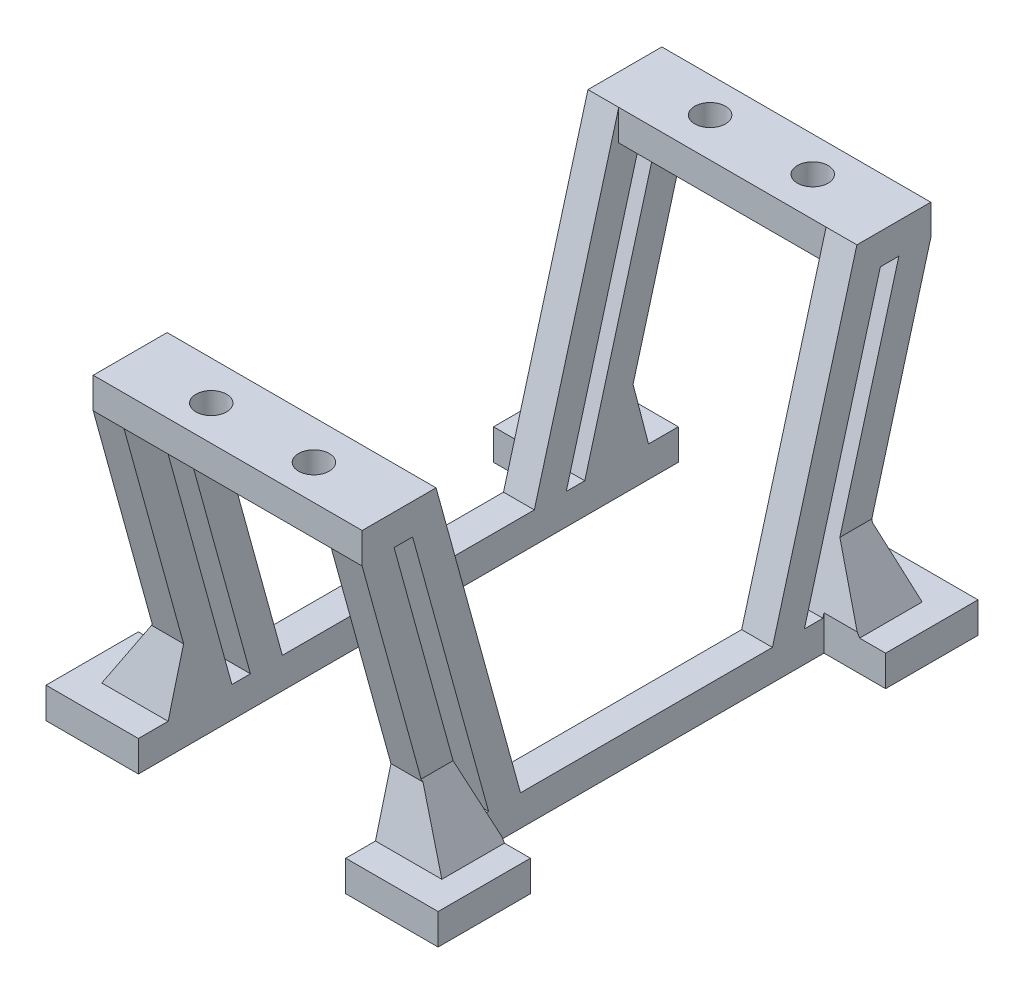
from build123d import *

# Parameters (mm, degrees)
BOSS_EXTRUDE2_DEPTH = 3
SKETCH6_W           = 7.2
SKETCH6_H           = 3
BOSS_EXTRUDE3_DEPTH = 10.1
SKETCH8_R           = 1.4975
CUT_EXTRUDE3_DEPTH  = 45.922405323
SKETCH9_W           = 9
SKETCH9_H           = 9
BOSS_EXTRUDE4_DEPTH = 3
CHAMFER2_SIZE       = 3.464101615
CHAMFER2_SIZE_2     = 6
CHAMFER2_SIZE_3     = 3.099985421


# Read off the part's stored shape, not the designer's step: Mirror10
with BuildPart() as part:
    # Sketch4 → Boss-Extrude2 (new body)
    with BuildSketch(Plane(origin=(10.1, 0, 0), x_dir=(0, 0, -1), z_dir=(1, 0, 0))):
        Polygon((0, 0), (20.3, 0), (20.3, 3), (27.7, 29.85), (27.7, 32.85), (20.5, 32.85), (12.273184358, 3), (0, 3), align=None)
        Polygon((22.785036556, 29.85), (15.385036556, 3), (17.188147801, 3), (24.588147801, 29.85), align=None, mode=Mode.SUBTRACT)
    boss_extrude2 = extrude(amount=BOSS_EXTRUDE2_DEPTH)

    # Sketch6 → Boss-Extrude3 (add)
    with BuildSketch(Plane.ZY.offset(-10.1)):
        with Locations((-24.1, 31.35)):
            Rectangle(SKETCH6_W, SKETCH6_H)
    boss_extrude3 = extrude(amount=BOSS_EXTRUDE3_DEPTH)

    # Sketch8 → Cut-Extrude3 (cut, through all)
    with BuildSketch(Plane(origin=(0, 32.85, 0), x_dir=(1, 0, 0), z_dir=(0, 1, 0))):
        with Locations(Location((5, 24.3, 0), (0, 0, 270))):
            Circle(SKETCH8_R)
    cut_extrude3 = extrude(amount=-CUT_EXTRUDE3_DEPTH, mode=Mode.SUBTRACT)

    # Sketch9 → Boss-Extrude4 (add)
    with BuildSketch(Plane.XZ):
        with Locations((14.6, -21.8)):
            Rectangle(SKETCH9_W, SKETCH9_H)
    boss_extrude4 = extrude(amount=-BOSS_EXTRUDE4_DEPTH)

    # Mirror9: Boss-Extrude2, Boss-Extrude3, Cut-Extrude3, Boss-Extrude4 across plane
    add(boss_extrude2.mirror(Plane(origin=(0, 0, 0), x_dir=(0, 0, 1), z_dir=(1, 0, 0))))
    add(boss_extrude3.mirror(Plane(origin=(0, 0, 0), x_dir=(0, 0, 1), z_dir=(1, 0, 0))))
    add(cut_extrude3.mirror(Plane(origin=(0, 0, 0), x_dir=(0, 0, 1), z_dir=(1, 0, 0))), mode=Mode.SUBTRACT)
    add(boss_extrude4.mirror(Plane(origin=(0, 0, 0), x_dir=(0, 0, 1), z_dir=(1, 0, 0))))

    # Mirror10: part across plane


with BuildPart() as part_1:
    add(part.part)
    add(part.part.mirror(Plane.XY))

    # Chamfer2
    # the kernel refuses this chamfer: 6, 3.464101615, 3.099985421 mm, written as the material it adds along each edge
    with BuildSketch(Plane(origin=(-13.1, 3, 17.3), x_dir=(-0.9983227437537925, -0.05789386240267071, 0), z_dir=(0, 0, 1))) as chamfer2_piece_1_section:
        Polygon((CHAMFER2_SIZE * 0.998322743793, -CHAMFER2_SIZE * 0.057893862405), (-CHAMFER2_SIZE_2 * 0.0578938624027, -CHAMFER2_SIZE_2 * 0.998322743754), (0, 0), align=None)
    chamfer2_piece_1 = extrude(amount=18.522514528, mode=Mode.PRIVATE)
    chamfer2_piece_1 = split(chamfer2_piece_1, bisect_by=Plane(origin=(-14.207429755, 4.623813367, 20.747531431), z_dir=(0, 0.2656988795293601, -0.9640560696436917)), keep=Keep.TOP, mode=Mode.PRIVATE)
    chamfer2_piece_1 = split(chamfer2_piece_1, bisect_by=Plane(origin=(-14.207429755, 5.420910005, 17.855363222), z_dir=(0, -0.26569887952935983, 0.9640560696436918)), keep=Keep.TOP, mode=Mode.PRIVATE)
    add(chamfer2_piece_1)
    with BuildSketch(Plane(origin=(-13.1, 3, -17.3), x_dir=(-0.9983227437537925, -0.05789386240267071, 0), z_dir=(0, 0, -1))) as chamfer2_piece_2_section:
        Polygon((CHAMFER2_SIZE * 0.998322743793, CHAMFER2_SIZE * 0.057893862405), (-CHAMFER2_SIZE_2 * 0.0578938624027, CHAMFER2_SIZE_2 * 0.998322743754), (0, 0), align=None)
    chamfer2_piece_2 = extrude(amount=18.522514528, mode=Mode.PRIVATE)
    chamfer2_piece_2 = split(chamfer2_piece_2, bisect_by=Plane(origin=(-14.207429755, 5.420910005, -17.855363222), z_dir=(0, -0.26569887952935983, -0.9640560696436918)), keep=Keep.TOP, mode=Mode.PRIVATE)
    chamfer2_piece_2 = split(chamfer2_piece_2, bisect_by=Plane(origin=(-14.207429755, 4.623813367, -20.747531431), z_dir=(0, 0.2656988795293601, 0.9640560696436917)), keep=Keep.TOP, mode=Mode.PRIVATE)
    add(chamfer2_piece_2)
    with BuildSketch(Plane(origin=(-10.1, 3, 20.3), x_dir=(0, -0.07329167604498149, 0.997310548536672), z_dir=(-1, 0, 0)), Plane(origin=(10.1, 3, -20.3), x_dir=(0, -0.07329167604498149, -0.997310548536672), z_dir=(1, 0, 0))) as chamfer2_piece_3:
        Polygon((CHAMFER2_SIZE_3 * 0.997310548488, CHAMFER2_SIZE_3 * 0.0732916760414), (CHAMFER2_SIZE_2 * 0.194327010143, CHAMFER2_SIZE_2 * 0.98093680384), (0, 0), align=None)
    extrude(amount=3)
    with BuildSketch(Plane(origin=(13.1, 3, 35.822514528), x_dir=(0.9983227437537925, -0.05789386240267071, 0), z_dir=(0, 0, -1))) as chamfer2_piece_4_section:
        Polygon((CHAMFER2_SIZE * 0.998322743793, -CHAMFER2_SIZE * 0.057893862405), (-CHAMFER2_SIZE_2 * 0.0578938624027, -CHAMFER2_SIZE_2 * 0.998322743754), (0, 0), align=None)
    chamfer2_piece_4 = extrude(amount=18.522514528, mode=Mode.PRIVATE)
    chamfer2_piece_4 = split(chamfer2_piece_4, bisect_by=Plane(origin=(14.207429755, 4.623813367, 20.747531431), z_dir=(0, 0.2656988795293601, -0.9640560696436917)), keep=Keep.TOP, mode=Mode.PRIVATE)
    chamfer2_piece_4 = split(chamfer2_piece_4, bisect_by=Plane(origin=(14.207429755, 5.420910005, 17.855363222), z_dir=(0, -0.26569887952935983, 0.9640560696436918)), keep=Keep.TOP, mode=Mode.PRIVATE)
    add(chamfer2_piece_4)
    with BuildSketch(Plane(origin=(13.1, 3, -35.822514528), x_dir=(0.9983227437537925, -0.05789386240267071, 0), z_dir=(0, 0, 1))) as chamfer2_piece_5_section:
        Polygon((CHAMFER2_SIZE * 0.998322743793, CHAMFER2_SIZE * 0.057893862405), (-CHAMFER2_SIZE_2 * 0.0578938624027, CHAMFER2_SIZE_2 * 0.998322743754), (0, 0), align=None)
    chamfer2_piece_5 = extrude(amount=18.522514528, mode=Mode.PRIVATE)
    chamfer2_piece_5 = split(chamfer2_piece_5, bisect_by=Plane(origin=(14.207429755, 4.623813367, -20.747531431), z_dir=(0, 0.2656988795293601, 0.9640560696436917)), keep=Keep.TOP, mode=Mode.PRIVATE)
    chamfer2_piece_5 = split(chamfer2_piece_5, bisect_by=Plane(origin=(14.207429755, 5.420910005, -17.855363222), z_dir=(0, -0.26569887952935983, -0.9640560696436918)), keep=Keep.TOP, mode=Mode.PRIVATE)
    add(chamfer2_piece_5)
    with BuildSketch(Plane(origin=(10.1, 3, 20.3), x_dir=(0, 0.9690111038190681, 0.24701716676245647), z_dir=(1, 0, 0))) as chamfer2_piece_6:
        Polygon((CHAMFER2_SIZE_2 * 0.999813220622, CHAMFER2_SIZE_2 * 0.0193267656127), (CHAMFER2_SIZE_3 * 0.247017166751, CHAMFER2_SIZE_3 * 0.969011103772), (0, 0), align=None)
    extrude(amount=3)
    with BuildSketch(Plane(origin=(-10.1, 3, -20.3), x_dir=(0, -0.07329167604498149, -0.997310548536672), z_dir=(-1, 0, 0))) as chamfer2_piece_7:
        Polygon((CHAMFER2_SIZE_3 * 0.997310548488, -CHAMFER2_SIZE_3 * 0.0732916760414), (CHAMFER2_SIZE_2 * 0.194327010143, -CHAMFER2_SIZE_2 * 0.98093680384), (0, 0), align=None)
    extrude(amount=3)
    with BuildSketch(Plane(origin=(-13.1, 3, 17.3), x_dir=(-0.9983227437537925, -0.05789386240267071, 0), z_dir=(0, 0, 1))) as chamfer2_piece_8a_section:
        Polygon((CHAMFER2_SIZE * 0.998322743793, -CHAMFER2_SIZE * 0.057893862405), (-CHAMFER2_SIZE_2 * 0.0578938624027, -CHAMFER2_SIZE_2 * 0.998322743754), (0, 0), align=None)
    chamfer2_piece_8a = extrude(amount=18.522514528, mode=Mode.PRIVATE)
    chamfer2_piece_8a = split(chamfer2_piece_8a, bisect_by=Plane(origin=(-14.24841762, 4.892203589, 26.3), z_dir=(0, 0, -1)), keep=Keep.TOP, mode=Mode.PRIVATE)
    chamfer2_piece_8a = split(chamfer2_piece_8a, bisect_by=Plane(origin=(-14.24841762, 5.593858539, 21.014880938), z_dir=(0, -0.2656988795293601, 0.9640560696436917)), keep=Keep.TOP, mode=Mode.PRIVATE)
    with BuildSketch(Plane(origin=(-10.1, 3, 20.3), x_dir=(0, -0.07329167604498149, 0.997310548536672), z_dir=(-1, 0, 0))) as chamfer2_piece_8b_section:
        Polygon((CHAMFER2_SIZE_3 * 0.997310548488, CHAMFER2_SIZE_3 * 0.0732916760414), (CHAMFER2_SIZE_2 * 0.194327010143, CHAMFER2_SIZE_2 * 0.98093680384), (0, 0), align=None)
    chamfer2_piece_8b = extrude(amount=18.522514528, mode=Mode.PRIVATE)
    chamfer2_piece_8b = split(chamfer2_piece_8b, bisect_by=Plane(origin=(-19.1, 4.952235463, 21.823438055), z_dir=(1, 0, 0)), keep=Keep.TOP, mode=Mode.PRIVATE)
    chamfer2_piece_8b = split(chamfer2_piece_8b, bisect_by=Plane(origin=(-13.1, 4.952235463, 21.823438055), z_dir=(-1, 0, 0)), keep=Keep.TOP, mode=Mode.PRIVATE)
    chamfer2_piece_8 = chamfer2_piece_8a & chamfer2_piece_8b
    add(chamfer2_piece_8)
    with BuildSketch(Plane(origin=(-13.1, 3, -17.3), x_dir=(-0.9983227437537925, -0.05789386240267071, 0), z_dir=(0, 0, -1))) as chamfer2_piece_9a_section:
        Polygon((CHAMFER2_SIZE * 0.998322743793, CHAMFER2_SIZE * 0.057893862405), (-CHAMFER2_SIZE_2 * 0.0578938624027, CHAMFER2_SIZE_2 * 0.998322743754), (0, 0), align=None)
    chamfer2_piece_9a = extrude(amount=18.522514528, mode=Mode.PRIVATE)
    chamfer2_piece_9a = split(chamfer2_piece_9a, bisect_by=Plane(origin=(-14.24841762, 4.892203589, -26.3), z_dir=(0, 0, 1)), keep=Keep.TOP, mode=Mode.PRIVATE)
    chamfer2_piece_9a = split(chamfer2_piece_9a, bisect_by=Plane(origin=(-14.24841762, 5.593858539, -21.014880938), z_dir=(0, -0.2656988795293601, -0.9640560696436917)), keep=Keep.TOP, mode=Mode.PRIVATE)
    with BuildSketch(Plane(origin=(-10.1, 3, -20.3), x_dir=(0, -0.07329167604498149, -0.997310548536672), z_dir=(-1, 0, 0))) as chamfer2_piece_9b_section:
        Polygon((CHAMFER2_SIZE_3 * 0.997310548488, -CHAMFER2_SIZE_3 * 0.0732916760414), (CHAMFER2_SIZE_2 * 0.194327010143, -CHAMFER2_SIZE_2 * 0.98093680384), (0, 0), align=None)
    chamfer2_piece_9b = extrude(amount=18.522514528, mode=Mode.PRIVATE)
    chamfer2_piece_9b = split(chamfer2_piece_9b, bisect_by=Plane(origin=(-19.1, 4.952235463, -21.823438055), z_dir=(1, 0, 0)), keep=Keep.TOP, mode=Mode.PRIVATE)
    chamfer2_piece_9b = split(chamfer2_piece_9b, bisect_by=Plane(origin=(-13.1, 4.952235463, -21.823438055), z_dir=(-1, 0, 0)), keep=Keep.TOP, mode=Mode.PRIVATE)
    chamfer2_piece_9 = chamfer2_piece_9a & chamfer2_piece_9b
    add(chamfer2_piece_9)
    with BuildSketch(Plane(origin=(10.1, 3, 20.3), x_dir=(0, 0.9690111038190681, 0.24701716676245647), z_dir=(1, 0, 0))) as chamfer2_piece_10a_section:
        Polygon((CHAMFER2_SIZE_2 * 0.999813220622, CHAMFER2_SIZE_2 * 0.0193267656127), (CHAMFER2_SIZE_3 * 0.247017166751, CHAMFER2_SIZE_3 * 0.969011103772), (0, 0), align=None)
    chamfer2_piece_10a = extrude(amount=18.522514528, mode=Mode.PRIVATE)
    chamfer2_piece_10a = split(chamfer2_piece_10a, bisect_by=Plane(origin=(13.1, 4.952235463, 21.823438055), z_dir=(1, 0, 0)), keep=Keep.TOP, mode=Mode.PRIVATE)
    chamfer2_piece_10a = split(chamfer2_piece_10a, bisect_by=Plane(origin=(19.1, 4.952235463, 21.823438055), z_dir=(-1, 0, 0)), keep=Keep.TOP, mode=Mode.PRIVATE)
    with BuildSketch(Plane(origin=(13.1, 3, 35.822514528), x_dir=(0.9983227437537925, -0.05789386240267071, 0), z_dir=(0, 0, -1))) as chamfer2_piece_10b_section:
        Polygon((CHAMFER2_SIZE * 0.998322743793, -CHAMFER2_SIZE * 0.057893862405), (-CHAMFER2_SIZE_2 * 0.0578938624027, -CHAMFER2_SIZE_2 * 0.998322743754), (0, 0), align=None)
    chamfer2_piece_10b = extrude(amount=18.522514528, mode=Mode.PRIVATE)
    chamfer2_piece_10b = split(chamfer2_piece_10b, bisect_by=Plane(origin=(14.24841762, 5.593858539, 21.014880938), z_dir=(0, -0.2656988795293601, 0.9640560696436917)), keep=Keep.TOP, mode=Mode.PRIVATE)
    chamfer2_piece_10b = split(chamfer2_piece_10b, bisect_by=Plane(origin=(14.24841762, 4.892203589, 26.3), z_dir=(0, 0, -1)), keep=Keep.TOP, mode=Mode.PRIVATE)
    chamfer2_piece_10 = chamfer2_piece_10a & chamfer2_piece_10b
    add(chamfer2_piece_10)
    with BuildSketch(Plane(origin=(13.1, 3, -35.822514528), x_dir=(0.9983227437537925, -0.05789386240267071, 0), z_dir=(0, 0, 1))) as chamfer2_piece_11a_section:
        Polygon((CHAMFER2_SIZE * 0.998322743793, CHAMFER2_SIZE * 0.057893862405), (-CHAMFER2_SIZE_2 * 0.0578938624027, CHAMFER2_SIZE_2 * 0.998322743754), (0, 0), align=None)
    chamfer2_piece_11a = extrude(amount=18.522514528, mode=Mode.PRIVATE)
    chamfer2_piece_11a = split(chamfer2_piece_11a, bisect_by=Plane(origin=(14.24841762, 4.892203589, -26.3), z_dir=(0, 0, 1)), keep=Keep.TOP, mode=Mode.PRIVATE)
    chamfer2_piece_11a = split(chamfer2_piece_11a, bisect_by=Plane(origin=(14.24841762, 5.593858539, -21.014880938), z_dir=(0, -0.2656988795293601, -0.9640560696436917)), keep=Keep.TOP, mode=Mode.PRIVATE)
    with BuildSketch(Plane(origin=(10.1, 3, -20.3), x_dir=(0, -0.07329167604498149, -0.997310548536672), z_dir=(1, 0, 0))) as chamfer2_piece_11b_section:
        Polygon((CHAMFER2_SIZE_3 * 0.997310548488, CHAMFER2_SIZE_3 * 0.0732916760414), (CHAMFER2_SIZE_2 * 0.194327010143, CHAMFER2_SIZE_2 * 0.98093680384), (0, 0), align=None)
    chamfer2_piece_11b = extrude(amount=18.522514528, mode=Mode.PRIVATE)
    chamfer2_piece_11b = split(chamfer2_piece_11b, bisect_by=Plane(origin=(19.1, 4.952235463, -21.823438055), z_dir=(-1, 0, 0)), keep=Keep.TOP, mode=Mode.PRIVATE)
    chamfer2_piece_11b = split(chamfer2_piece_11b, bisect_by=Plane(origin=(13.1, 4.952235463, -21.823438055), z_dir=(1, 0, 0)), keep=Keep.TOP, mode=Mode.PRIVATE)
    chamfer2_piece_11 = chamfer2_piece_11a & chamfer2_piece_11b
    add(chamfer2_piece_11)


solid = part_1.part
